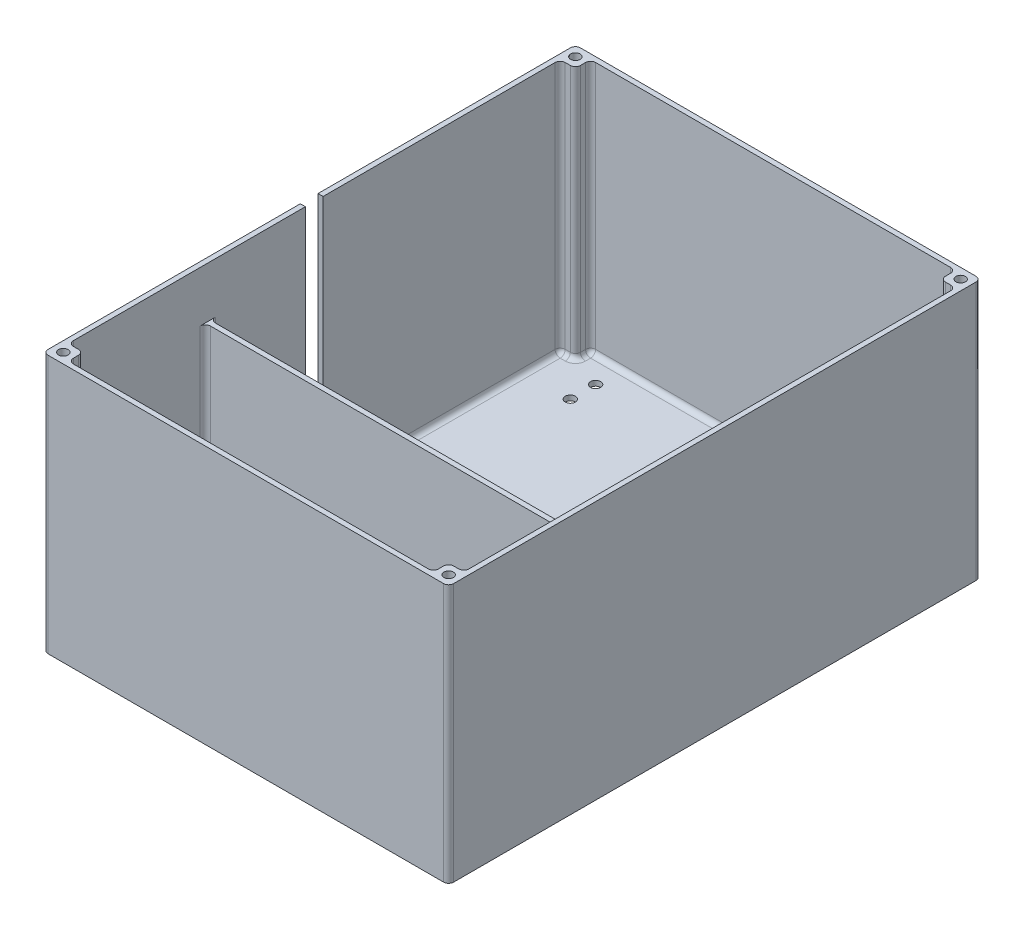
from build123d import *

# Parameters (mm, degrees)
SKETCH1_W           = 160
SKETCH1_H           = 210
BOSS_EXTRUDE3_DEPTH = 2
SKETCH3_W           = 160
SKETCH3_H           = 210
BOSS_EXTRUDE4_DEPTH = 100
FILLET1_R           = 2
SKETCH4_R           = 1.875
CUT_EXTRUDE1_DEPTH  = 10
SKETCH5_R           = 2
CUT_EXTRUDE2_DEPTH  = 10
SKETCH6_W           = 156
SKETCH6_H           = 2
BOSS_EXTRUDE5_DEPTH = 80
FILLET2_R           = 2
CUT_EXTRUDE3_DEPTH  = 10


with BuildPart() as part:
    # Sketch1 → Boss-Extrude3 (new body)
    with BuildSketch(Plane(origin=(0, 0, 0), x_dir=(1, 0, 0), z_dir=(0, 1, 0))):
        with Locations((80, 105)):
            Rectangle(SKETCH1_W, SKETCH1_H)
    extrude(amount=BOSS_EXTRUDE3_DEPTH)

    # Sketch3 → Boss-Extrude4 (add)
    with BuildSketch(Plane(origin=(0, 2, 0), x_dir=(1, 0, 0), z_dir=(0, 1, 0))):
        with Locations((80, 105)):
            Rectangle(SKETCH3_W, SKETCH3_H)
        Polygon((2, 202), (2, 8), (8, 8), (8, 2), (152, 2), (152, 8), (158, 8), (158, 202), (152, 202), (152, 208), (8, 208), (8, 202), align=None, mode=Mode.SUBTRACT)
    extrude(amount=BOSS_EXTRUDE4_DEPTH)

    # Fillet1
    fillet1_edges = [part.edges().sort_by_distance(p)[0] for p in [
        (160, 51, -210),
        (160, 51, 0),
        (0, 51, 0),
        (0, 51, -210),
        (2, 52, -8),
        (8, 52, -8),
        (8, 52, -2),
        (152, 52, -2),
        (152, 52, -8),
        (158, 52, -8),
        (158, 52, -202),
        (152, 52, -202),
        (152, 52, -208),
        (8, 52, -202),
        (8, 52, -208),
        (2, 52, -202),
    ]]
    fillet(fillet1_edges, radius=FILLET1_R)

    # Sketch4 → Cut-Extrude1 (cut)
    with BuildSketch(Plane(origin=(0, 102, 0), x_dir=(1, 0, 0), z_dir=(0, 1, 0))):
        with Locations((4, 206)):
            Circle(SKETCH4_R)
        with Locations((156, 206)):
            Circle(SKETCH4_R)
        with Locations((156, 4)):
            Circle(SKETCH4_R)
        with Locations((4, 4)):
            Circle(SKETCH4_R)
    extrude(amount=-CUT_EXTRUDE1_DEPTH, mode=Mode.SUBTRACT)

    # Sketch5 → Cut-Extrude2 (cut)
    with BuildSketch(Plane(origin=(0, 2, 0), x_dir=(1, 0, 0), z_dir=(0, 1, 0))):
        with Locations((20, 198)):
            Circle(SKETCH5_R)
        with Locations((140, 198)):
            Circle(SKETCH5_R)
        with Locations((140, 188)):
            Circle(SKETCH5_R)
        with Locations((20, 188)):
            Circle(SKETCH5_R)
        with Locations((20, 22)):
            Circle(SKETCH5_R)
        with Locations((140, 22)):
            Circle(SKETCH5_R)
        with Locations((140, 12)):
            Circle(SKETCH5_R)
        with Locations((20, 12)):
            Circle(SKETCH5_R)
    extrude(amount=-CUT_EXTRUDE2_DEPTH, mode=Mode.SUBTRACT)

    # Sketch6 → Boss-Extrude5 (add)
    with BuildSketch(Plane(origin=(0, 2, 0), x_dir=(1, 0, 0), z_dir=(0, 1, 0))):
        with Locations((80, 63)):
            Rectangle(SKETCH6_W, SKETCH6_H)
    extrude(amount=BOSS_EXTRUDE5_DEPTH)

    # Fillet2
    fillet2_edges = [part.edges().sort_by_distance(p)[0] for p in [
        (158, 2, -36),
        (157.414213562, 2, -8.585786438),
        (155, 2, -8),
        (152.585786438, 2, -7.414213562),
        (152, 2, -5),
        (151.414213562, 2, -2.585786438),
        (80, 2, -2),
        (8.585786438, 2, -2.585786438),
        (8, 2, -5),
        (7.414213562, 2, -7.414213562),
        (5, 2, -8),
        (2.585786438, 2, -8.585786438),
        (158, 2, -132),
        (157.414213562, 2, -201.414213562),
        (155, 2, -202),
        (152.585786438, 2, -202.585786438),
        (152, 2, -205),
        (151.414213562, 2, -207.414213562),
        (80, 2, -208),
        (8.585786438, 2, -207.414213562),
        (8, 2, -205),
        (7.414213562, 2, -202.585786438),
        (5, 2, -202),
        (2.585786438, 2, -201.414213562),
        (2, 2, -36),
        (2, 42, -62),
        (80, 2, -62),
        (158, 42, -62),
        (158, 42, -64),
        (2, 42, -64),
        (80, 2, -64),
        (2, 2, -132),
    ]]
    fillet(fillet2_edges, radius=FILLET2_R)

    # Sketch7 → Cut-Extrude3 (cut)
    with BuildSketch(Plane.ZY):
        with BuildLine():
            Line((-108.5, 102), (-101.5, 102))
            Line((-101.5, 102), (-101.5, 29.745966692))
            ThreePointArc((-101.5, 29.745966692), (-105, 13.5), (-108.5, 29.745966692))
            Line((-108.5, 29.745966692), (-108.5, 102))
        make_face()
    extrude(amount=-CUT_EXTRUDE3_DEPTH, mode=Mode.SUBTRACT)


solid = part.part
